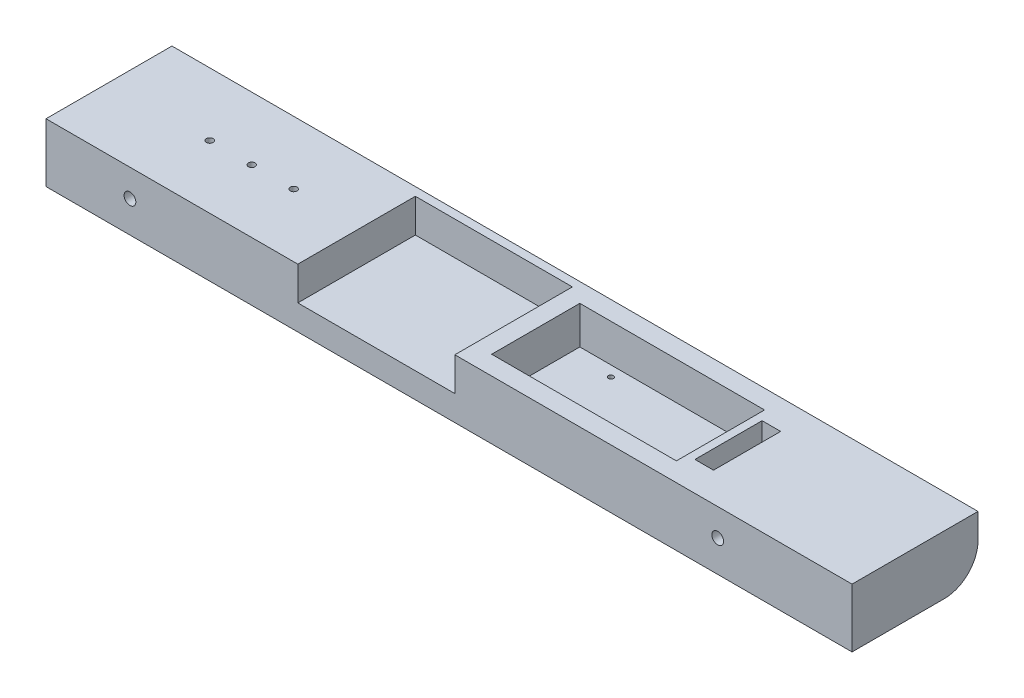
from build123d import *

# Parameters (mm, degrees)
SKETCH1_W               = 38.1
SKETCH1_H               = 17.78
BOSS_EXTRUDE1_DEPTH     = 243.84
SKETCH2_W               = 55.88
SKETCH2_H               = 26.67
CUT_EXTRUDE1_DEPTH      = 11.43
SKETCH3_W               = 47.498
SKETCH3_H               = 35.56
CUT_EXTRUDE2_DEPTH      = 10.16
SKETCH4_R               = 1.778
CUT_EXTRUDE3_DEPTH      = 25.4
SKETCH5_R               = 1.016
CUT_EXTRUDE4_DEPTH      = 10.16
SKETCH6_R               = 0.762
CUT_EXTRUDE5_DEPTH      = 6.35
LPATTERN1_COUNT         = 2
LPATTERN1_PITCH         = 38.1
LPATTERN2_COUNT         = 3
LPATTERN2_PITCH         = 12.7
MIRROR2_COPY_1_SKETCH_R = 0.762
MIRROR2_COPY_1_DEPTH    = 6.35
SKETCH7_W               = 5.626456328
SKETCH7_H               = 20.32
CUT_EXTRUDE6_DEPTH      = 248.4382428
MIRROR3_COPY_1_SKETCH_R = 0.762
MIRROR3_COPY_1_DEPTH    = 6.35
MIRROR3_COPY_2_SKETCH_R = 0.762
MIRROR3_COPY_2_DEPTH    = 6.35
MIRROR3_COPY_3_SKETCH_R = 0.762
MIRROR3_COPY_3_DEPTH    = 6.35
SKETCH8_R               = 0.762
BOSS_EXTRUDE2_DEPTH     = 17.78
FILLET1_R               = 10.16
BOSS_EXTRUDE3_DEPTH     = 20.955
SKETCH12_R              = 0.762
CUT_EXTRUDE8_DEPTH      = 248.063150834
FILLET2_R               = 6.35


with BuildPart() as part:
    # Sketch1 → Boss-Extrude1 (new body)
    with BuildSketch(Plane(origin=(0, 0, 0), x_dir=(0, 0, -1), z_dir=(1, 0, 0))):
        with Locations((19.05, -8.89)):
            Rectangle(SKETCH1_W, SKETCH1_H)
    extrude(amount=BOSS_EXTRUDE1_DEPTH)

    # Sketch2 → Cut-Extrude1 (cut)
    with BuildSketch(Plane(origin=(0, 0, 0), x_dir=(1, 0, 0), z_dir=(0, 1, 0))):
        with Locations((157.044117332, 19.05)):
            Rectangle(SKETCH2_W, SKETCH2_H)
    extrude(amount=-CUT_EXTRUDE1_DEPTH, mode=Mode.SUBTRACT)

    # Sketch3 → Cut-Extrude2 (cut)
    with BuildSketch(Plane(origin=(0, 0, 0), x_dir=(1, 0, 0), z_dir=(0, 1, 0))):
        with Locations((99.926945865, 17.78)):
            Rectangle(SKETCH3_W, SKETCH3_H)
    extrude(amount=-CUT_EXTRUDE2_DEPTH, mode=Mode.SUBTRACT)

    # Sketch4 → Cut-Extrude3 (cut)
    with BuildSketch(Plane.XY):
        with Locations((25.4, -8.255)):
            Circle(SKETCH4_R)
        with Locations((203.2, -8.255)):
            Circle(SKETCH4_R)
    extrude(amount=-CUT_EXTRUDE3_DEPTH, mode=Mode.SUBTRACT)

    # Sketch5 → Cut-Extrude4 (cut)
    with BuildSketch(Plane(origin=(0, 0, 0), x_dir=(1, 0, 0), z_dir=(0, 1, 0))):
        with Locations(Location((55.88, 19.05, 0), (0, 0, 270))):
            Circle(SKETCH5_R)
    cut_extrude4 = extrude(amount=-CUT_EXTRUDE4_DEPTH, mode=Mode.SUBTRACT)

    # Sketch6 → Cut-Extrude5 (cut)
    with BuildSketch(Plane(origin=(0, 0, 0), x_dir=(1, 0, 0), z_dir=(0, 1, 0))):
        with Locations(Location((200.66, 29.21, 0), (0, 0, 270))):
            Circle(SKETCH6_R)
        with Locations(Location((200.66, 8.89, 0), (0, 0, 270))):
            Circle(SKETCH6_R)
    cut_extrude5 = extrude(amount=-CUT_EXTRUDE5_DEPTH, mode=Mode.SUBTRACT)

    # LPattern1: Cut-Extrude5 ×2
    with Locations(*[(i * LPATTERN1_PITCH, 0, 0) for i in range(1, LPATTERN1_COUNT)]):
        add(cut_extrude5, mode=Mode.SUBTRACT)

    # LPattern2: Cut-Extrude4 ×3
    with Locations(*[(-i * LPATTERN2_PITCH, 0, 0) for i in range(1, LPATTERN2_COUNT)]):
        add(cut_extrude4, mode=Mode.SUBTRACT)

    # Mirror2: Cut-Extrude5 across plane
    add(cut_extrude5.mirror(Plane.ZX.offset(-8.89)), mode=Mode.SUBTRACT)

    # Mirror2 copy 1 sketch → Mirror2 copy 1 (cut)
    with BuildSketch(Plane(origin=(38.1, -17.78, 0), x_dir=(1, 0, 0), z_dir=(0, -1, 0))):
        with Locations((200.66, -29.21)):
            Circle(MIRROR2_COPY_1_SKETCH_R)
        with Locations((200.66, -8.89)):
            Circle(MIRROR2_COPY_1_SKETCH_R)
    extrude(amount=-MIRROR2_COPY_1_DEPTH, mode=Mode.SUBTRACT)

    # Sketch7 → Cut-Extrude6 (cut, through all)
    with BuildSketch(Plane.XZ.offset(17.78)):
        with Locations((190.226771836, -19.05)):
            Rectangle(SKETCH7_W, SKETCH7_H)
    extrude(amount=-CUT_EXTRUDE6_DEPTH, mode=Mode.SUBTRACT)

    # Mirror3 copy 1 sketch → Mirror3 copy 1 (cut)
    with BuildSketch(Plane(origin=(380.453543672, -17.78, 0), x_dir=(-1, 0, 0), z_dir=(0, -1, 0))):
        with Locations(Location((200.66, 29.21, 0), (0, 0, 270))):
            Circle(MIRROR3_COPY_1_SKETCH_R)
        with Locations(Location((200.66, 8.89, 0), (0, 0, 270))):
            Circle(MIRROR3_COPY_1_SKETCH_R)
    extrude(amount=-MIRROR3_COPY_1_DEPTH, mode=Mode.SUBTRACT)

    # Mirror3 copy 2 sketch → Mirror3 copy 2 (cut)
    with BuildSketch(Plane(origin=(342.353543672, -17.78, 0), x_dir=(-1, 0, 0), z_dir=(0, -1, 0))):
        with Locations(Location((200.66, 29.21, 0), (0, 0, 270))):
            Circle(MIRROR3_COPY_2_SKETCH_R)
        with Locations(Location((200.66, 8.89, 0), (0, 0, 270))):
            Circle(MIRROR3_COPY_2_SKETCH_R)
    extrude(amount=-MIRROR3_COPY_2_DEPTH, mode=Mode.SUBTRACT)

    # Mirror3 copy 3 sketch → Mirror3 copy 3 (cut)
    with BuildSketch(Plane(origin=(380.453543672, 0, 0), x_dir=(-1, 0, 0), z_dir=(0, 1, 0))):
        with Locations((200.66, -29.21)):
            Circle(MIRROR3_COPY_3_SKETCH_R)
        with Locations((200.66, -8.89)):
            Circle(MIRROR3_COPY_3_SKETCH_R)
    extrude(amount=-MIRROR3_COPY_3_DEPTH, mode=Mode.SUBTRACT)

    # Sketch8 → Boss-Extrude2 (add)
    with BuildSketch(Plane.XZ.offset(17.78)):
        with Locations((200.66, -8.89)):
            Circle(SKETCH8_R)
        with Locations((238.76, -8.89)):
            Circle(SKETCH8_R)
        with Locations((238.76, -29.21)):
            Circle(SKETCH8_R)
        with Locations((200.66, -29.21)):
            Circle(SKETCH8_R)
    extrude(amount=-BOSS_EXTRUDE2_DEPTH)

    # Fillet1
    # the kernel refuses this fillet: 10.16 mm, written as the material it takes off along each edge
    with BuildSketch(Plane(origin=(-25.4, -17.78, -38.1), x_dir=(0, 1, 0), z_dir=(1, 0, 0))) as fillet1_piece_1:
        with BuildLine():
            CenterArc((FILLET1_R, FILLET1_R), FILLET1_R, 180, 90)
            Line((0, FILLET1_R), (0, 0))
            Line((0, 0), (FILLET1_R, 0))
        make_face()
    extrude(amount=294.64, mode=Mode.SUBTRACT)

    # Sketch11 → Boss-Extrude3 (add, symmetric)
    with BuildSketch(Plane(origin=(160.743543672, 0, 0), x_dir=(0, 0, -1), z_dir=(1, 0, 0))):
        with BuildLine():
            Line((27.94, -17.78), (38.1, -17.78))
            Line((38.1, -17.78), (38.1, -7.62))
            ThreePointArc((38.1, -7.62), (35.124204897, -14.804204897), (27.94, -17.78))
        make_face()
    extrude(amount=BOSS_EXTRUDE3_DEPTH, both=True)

    # Sketch12 → Cut-Extrude8 (cut, through all)
    with BuildSketch(Plane(origin=(0, -11.43, 0), x_dir=(1, 0, 0), z_dir=(0, 1, 0))):
        with Locations(Location((141.693543672, 29.21, 0), (0, 0, 270))):
            Circle(SKETCH12_R)
        with Locations(Location((179.793543672, 29.21, 0), (0, 0, 270))):
            Circle(SKETCH12_R)
    extrude(amount=-CUT_EXTRUDE8_DEPTH, mode=Mode.SUBTRACT)

    # Fillet2
    fillet2_edges = [part.edges().sort_by_distance(p)[0] for p in [
        (160.743543672, -17.78, -38.1),
    ]]
    fillet(fillet2_edges, radius=FILLET2_R)


solid = part.part
